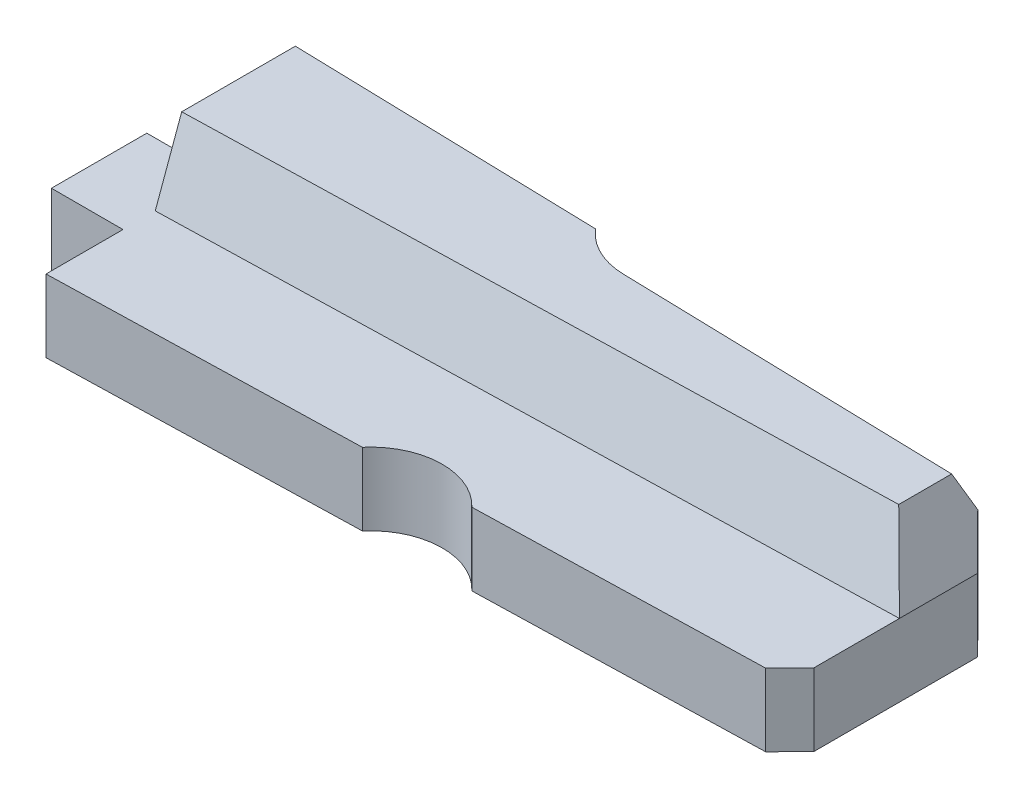
from build123d import *

# Parameters (mm, degrees)
BOSS_EXTRUDE1_DEPTH = 6.08
BOSS_EXTRUDE2_DEPTH = 6.09
SKETCH4_W           = 70.899698082
SKETCH4_H           = 9.313865989
CUT_EXTRUDE4_DEPTH  = 13.09
SKETCH5_W           = 29.305939782
SKETCH5_H           = 12.234342693
CUT_EXTRUDE5_DEPTH  = 19.09
SKETCH6_R           = 6
CUT_EXTRUDE6_DEPTH  = 60.839839878
CUT_EXTRUDE7_DEPTH  = 11.09
SKETCH10_W          = 36.097359295
SKETCH10_H          = 22.987225517
CUT_EXTRUDE11_DEPTH = 63.929843377
SKETCH12_W          = 8
SKETCH12_H          = 6.08
BOSS_EXTRUDE4_DEPTH = 6


with BuildPart() as part:
    # Sketch1 → Boss-Extrude1 (new body)
    with BuildSketch(Plane(origin=(0, 0, 0), x_dir=(1, 0, 0), z_dir=(0, 1, 0))):
        Polygon((-14.914047624, 10.796093069), (-14.914047624, -10.733906931), (57.585952376, -8.821379846), (57.585952376, 8.878620154), align=None)
    extrude(amount=BOSS_EXTRUDE1_DEPTH)

    # Sketch2 → Boss-Extrude2 (add)
    with BuildSketch(Plane(origin=(0, 6.08, 0), x_dir=(1, 0, 0), z_dir=(0, 1, 0))):
        Polygon((-13.064047624, 10.74716445), (-13.064047624, -1.521917904), (57.585952376, 0.341806766), (57.585952376, 8.878620154), align=None)
    extrude(amount=BOSS_EXTRUDE2_DEPTH)

    # Sketch4 → Cut-Extrude4 (cut)
    with BuildSketch(Plane(origin=(0.078934537, 1.089467811, 2.992247256), x_dir=(0.9996522376299903, 0, -0.026370510070028146), z_dir=(0.02478017371916596, 0.34202014332566605, 0.9393658310530242))):
        with Locations((22.35021085, 9.967746424)):
            Rectangle(SKETCH4_W, SKETCH4_H)
    extrude(amount=CUT_EXTRUDE4_DEPTH, mode=Mode.SUBTRACT)

    # Sketch5 → Cut-Extrude5 (cut)
    with BuildSketch(Plane(origin=(52.803749931, 19.218993233, 0), x_dir=(0, 0, -1), z_dir=(0.9396926207859081, 0.34202014332566943, 1.2295842975475839e-15))):
        with Locations((0.411188199, -7.865053205)):
            Rectangle(SKETCH5_W, SKETCH5_H)
    extrude(amount=CUT_EXTRUDE5_DEPTH, mode=Mode.SUBTRACT)

    # Sketch6 → Cut-Extrude6 (cut, through all)
    with BuildSketch(Plane.XZ):
        with Locations((27.215952376, 13.62392238)):
            Circle(SKETCH6_R)
        with Locations((27.215952376, -13.683241685)):
            Circle(SKETCH6_R)
        Polygon((-14.914047624, 10.733906931), (-14.914047624, 8.733906931), (-12.914047624, 10.681147563), align=None)
        Polygon((-14.914047624, -10.796093069), (-12.914047624, -10.743197265), (-14.914047624, -8.796093069), align=None)
        Polygon((55.586647901, 8.874120866), (57.585952376, 8.821379846), (57.585952376, 6.821379846), align=None)
        Polygon((57.585952376, -8.878620154), (57.585952376, -6.878620154), (55.585952376, -8.931515959), align=None)
    extrude(amount=-CUT_EXTRUDE6_DEPTH, mode=Mode.SUBTRACT)

    # Sketch7 → Cut-Extrude7 (cut)
    with BuildSketch(Plane(origin=(0.305261026, 5.260141687, -11.541974951), x_dir=(-0.9997105289622884, 0.009976365195544153, -0.021893615951381312), z_dir=(0.024059473814631405, 0.4145836859950284, -0.9096930850712998))):
        Polygon((-26.921663821, 7.88786599), (-26.921663821, 3.064364781), (-63.575410801, 3.466220434), (-63.575410801, 10.38968732), (-26.921663821, 9.987831666), align=None)
    extrude(amount=CUT_EXTRUDE7_DEPTH, mode=Mode.SUBTRACT)

    # Sketch10 → Cut-Extrude11 (cut, through all)
    with BuildSketch(Plane.ZY.offset(3.214047624)):
        with Locations((0.41938451, 3.731019242)):
            Rectangle(SKETCH10_W, SKETCH10_H)
    extrude(amount=CUT_EXTRUDE11_DEPTH, mode=Mode.SUBTRACT)

    # Sketch12 → Boss-Extrude4 (add)
    with BuildSketch(Plane.ZY.offset(3.214047624)):
        with Locations((-0.030693992, 3.04)):
            Rectangle(SKETCH12_W, SKETCH12_H)
    extrude(amount=BOSS_EXTRUDE4_DEPTH)


solid = part.part
